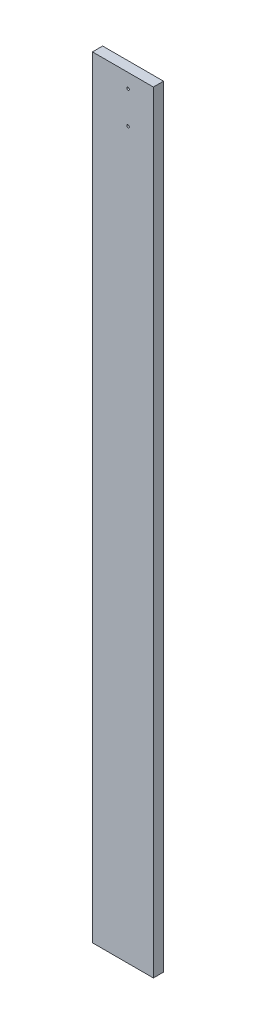
from build123d import *

# Parameters (mm, degrees)
SKETCH1_W           = 38.1
SKETCH1_H           = 482.6
BOSS_EXTRUDE1_DEPTH = 3.175
SKETCH2_R           = 0.79375
CUT_EXTRUDE1_DEPTH  = 243.716238641


with BuildPart() as part:
    # Sketch1 → Boss-Extrude1 (new, symmetric)
    with BuildSketch(Plane.XY):
        with Locations((-6.35, 0)):
            Rectangle(SKETCH1_W, SKETCH1_H)
    extrude(amount=BOSS_EXTRUDE1_DEPTH, both=True)

    # Sketch2 → Cut-Extrude1 (cut, through all)
    with BuildSketch(Plane.XY.offset(3.175)):
        with Locations((-3.16, 232.41)):
            Circle(SKETCH2_R)
        with Locations((-3.16, 212.09)):
            Circle(SKETCH2_R)
    extrude(amount=-CUT_EXTRUDE1_DEPTH, mode=Mode.SUBTRACT)


solid = part.part
